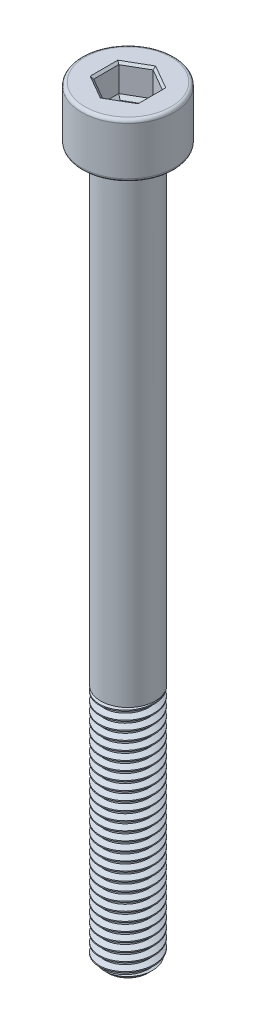
from build123d import *

# Parameters (mm, degrees)
SKETCH1_R           = 2.5
BOSS_EXTRUDE1_DEPTH = 22
THREAD1_PITCH       = 0.8
SKETCH2_R           = 2.5
BOSS_EXTRUDE2_DEPTH = 43
SKETCH3_R           = 4.25
BOSS_EXTRUDE3_DEPTH = 5
FILLET1_R           = 0.3
CUT_EXTRUDE1_DEPTH  = 2.5
CHAMFER1_SIZE       = 0.2
CUT_EXTRUDE2_DEPTH  = 0.3
CUT_EXTRUDE2_DRAFT  = -45


with BuildPart() as part:
    # Sketch1 → Boss-Extrude1 (new body)
    with BuildSketch(Plane(origin=(0, 0, 0), x_dir=(1, 0, 0), z_dir=(0, 1, 0))):
        with Locations(Location((0, 0, 0), (0, 0, 270))):
            Circle(SKETCH1_R)
    extrude(amount=BOSS_EXTRUDE1_DEPTH)

    # Thread1: the profile of Thread Profile1 profile screwed along a right-hand helix of 28.75 turns, 8 arcs to a turn; built about Z, then put on its axis
    thread1_z = Axis((0, 0, 0), (0, 0, 1))
    thread1_corners = [(2.5003, 0, -0.000173205), (2.5003, 0, 0.700173203), (2.0669873, 0, 0.449999999), (2.0669873, 0, 0.249999999)]
    with BuildLine(mode=Mode.PRIVATE) as thread1_profile:
        Line(thread1_corners[0], thread1_corners[1])
        Line(thread1_corners[1], thread1_corners[2])
        Line(thread1_corners[2], thread1_corners[3])
        Line(thread1_corners[3], thread1_corners[0])
    thread1_cap = Face(thread1_profile.wire())
    thread1_turn_angles = [0, 22.5, 45, 67.5, 90, 112.5, 135, 157.5, 180, 202.5, 225, 247.5, 270, 292.5, 315, 337.5, 360]
    thread1_turn_weights = [1, 0.9238795325112867, 1, 0.9238795325112867, 1, 0.9238795325112867, 1, 0.9238795325112867, 1, 0.9238795325112867, 1, 0.9238795325112867, 1, 0.9238795325112867, 1, 0.9238795325112867, 1]
    thread1_turn_rails = [Edge.make_bspline([Vector(p[0], p[1], 0).rotate(thread1_z, thread1_turn_angles[k]) / thread1_turn_weights[k] + Vector(0, 0, p[2] + THREAD1_PITCH * thread1_turn_angles[k] / 360) for k in range(17)], [0, 0, 0, 1, 1, 2, 2, 3, 3, 4, 4, 5, 5, 6, 6, 7, 7, 8, 8, 8], 2, thread1_turn_weights) for p in thread1_corners]
    thread1_turn_sides = [Face.make_surface_from_curves(thread1_turn_rails[p[0]], thread1_turn_rails[p[1]]) for p in [(0, 1), (1, 2), (2, 3), (3, 0)]]
    thread1_last_angles = [10080, 10102.5, 10125, 10147.5, 10170, 10192.5, 10215, 10237.5, 10260, 10282.5, 10305, 10327.5, 10350]
    thread1_last_weights = [1, 0.9238795325112867, 1, 0.9238795325112867, 1, 0.9238795325112867, 1, 0.9238795325112867, 1, 0.9238795325112867, 1, 0.9238795325112867, 1]
    thread1_last_rails = [Edge.make_bspline([Vector(p[0], p[1], 0).rotate(thread1_z, thread1_last_angles[k]) / thread1_last_weights[k] + Vector(0, 0, p[2] + THREAD1_PITCH * thread1_last_angles[k] / 360) for k in range(13)], [0, 0, 0, 1, 1, 2, 2, 3, 3, 4, 4, 5, 5, 6, 6, 6], 2, thread1_last_weights) for p in thread1_corners]
    thread1_last_sides = [Face.make_surface_from_curves(thread1_last_rails[p[0]], thread1_last_rails[p[1]]) for p in [(0, 1), (1, 2), (2, 3), (3, 0)]]
    thread1 = Plane(origin=(0, 23, 0), x_dir=(-1, 0, 0), z_dir=(0, -1, 0)) * Solid(Shell([*[p.moved(Location((0, 0, THREAD1_PITCH * i))) for i in range(28) for p in thread1_turn_sides], *thread1_last_sides, thread1_cap, thread1_cap.rotate(thread1_z, 10350).moved(Location((0, 0, THREAD1_PITCH * 10350 / 360)))]))
    add(thread1, mode=Mode.SUBTRACT)

    # Sketch2 → Boss-Extrude2 (add)
    with BuildSketch(Plane(origin=(0, 22, 0), x_dir=(1, 0, 0), z_dir=(0, 1, 0))):
        with Locations(Location((0, 0, 0), (0, 0, 90))):
            Circle(SKETCH2_R)
    extrude(amount=BOSS_EXTRUDE2_DEPTH)

    # Sketch3 → Boss-Extrude3 (add)
    with BuildSketch(Plane(origin=(0, 65, 0), x_dir=(1, 0, 0), z_dir=(0, 1, 0))):
        with Locations(Location((0, 0, 0), (0, 0, 270))):
            Circle(SKETCH3_R)
    extrude(amount=BOSS_EXTRUDE3_DEPTH)

    # Fillet1
    fillet1_edges = [part.edges().sort_by_distance(p)[0] for p in [
        (0, 65, -4.25),
        (0, 70, -4.25),
    ]]
    fillet(fillet1_edges, radius=FILLET1_R)

    # Sketch4 → Cut-Revolve1 (revolve, cut)
    with BuildSketch(Plane.XY, mode=Mode.PRIVATE) as cut_revolve1_sk:
        Polygon((2.51, 0), (2.51, 0.7), (1.81, 0), align=None)
    revolve(cut_revolve1_sk.sketch.rotate(Axis((0, 0, 0), (0, 1, 0)), 90), axis=Axis((0, 0, 0), (0, 1, 0)), mode=Mode.SUBTRACT)

    # Sketch5 → Cut-Extrude1 (cut)
    with BuildSketch(Plane(origin=(0, 70, 0), x_dir=(1, 0, 0), z_dir=(0, 1, 0))):
        Polygon((0, 2.309401077), (-2, 1.154700538), (-2, -1.154700538), (0, -2.309401077), (2, -1.154700538), (2, 1.154700538), align=None)
    extrude(amount=-CUT_EXTRUDE1_DEPTH, mode=Mode.SUBTRACT)

    # Chamfer1
    chamfer1_edges = [part.edges().sort_by_distance(p)[0] for p in [
        (1, 70, -1.732050808),
        (-1, 70, -1.732050808),
        (-2, 70, 0),
        (-1, 70, 1.732050808),
        (1, 70, 1.732050808),
        (2, 70, 0),
    ]]
    chamfer(chamfer1_edges, length=CHAMFER1_SIZE)


with BuildPart() as cut_extrude2_tool:
    # Sketch6 → Cut-Extrude2 (with draft: the straight prism first)
    with BuildSketch(Plane(origin=(0, 67.5, 0), x_dir=(1, 0, 0), z_dir=(0, 1, 0))):
        Polygon((0, 2.309401077), (-2, 1.154700538), (-2, -1.154700538), (0, -2.309401077), (2, -1.154700538), (2, 1.154700538), align=None)
    extrude(amount=-CUT_EXTRUDE2_DEPTH)
    # Cut-Extrude2: the draft: its side faces are tilted about the plane it starts from
    cut_extrude2_sides = [cut_extrude2_tool.faces().sort_by_distance(p)[0] for p in [
        (-1, 67.35, -1.732050808),
        (-2, 67.35, 0),
        (-1, 67.35, 1.732050808),
        (1, 67.35, 1.732050808),
        (2, 67.35, 0),
        (1, 67.35, -1.732050808),
    ]]
    draft(cut_extrude2_sides, Plane(origin=(0, 67.5, 0), x_dir=(1, 0, 0), z_dir=(0, 1, 0)), CUT_EXTRUDE2_DRAFT)


with BuildPart() as part_1:
    add(part.part)

    # Cut-Extrude2: cut by cut_extrude2_tool
    add(cut_extrude2_tool.part, mode=Mode.SUBTRACT)


solid = part_1.part
